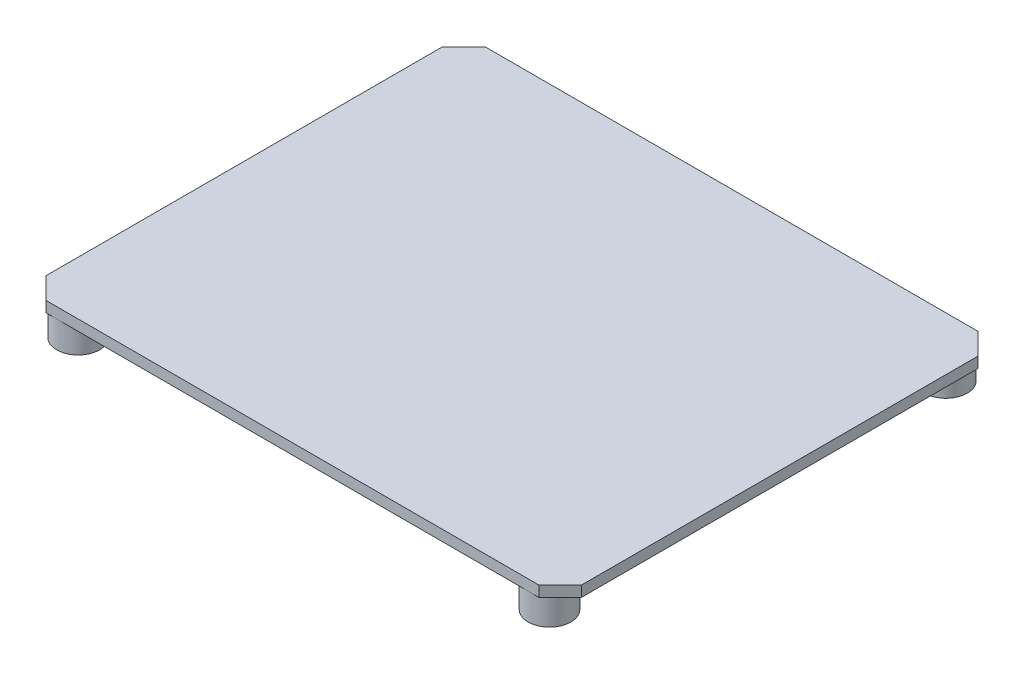
from build123d import *

# Parameters (mm, degrees)
SHADE_PLATE_DEPTH = 2
SKETCH2_R         = 4
POSTS_DEPTH       = 5.1
SKETCH3_R         = 1.25
POST_PILOTS_DEPTH = 6.5


with BuildPart() as part:
    # Sketch1 → Shade Plate (new body)
    with BuildSketch(Plane(origin=(0, 33.4, 0), x_dir=(1, 0, 0), z_dir=(0, 1, 0))):
        Polygon((-46, -102), (46, -102), (50, -98), (50, -24), (46, -20), (-46, -20), (-50, -24), (-50, -98), align=None)
    extrude(amount=SHADE_PLATE_DEPTH)

    # Sketch2 → Posts (add)
    with BuildSketch(Plane(origin=(0, 28.4, 0), x_dir=(1, 0, 0), z_dir=(0, 1, 0))):
        with Locations((-44, -24)):
            Circle(SKETCH2_R)
        with Locations((-44, -98)):
            Circle(SKETCH2_R)
        with Locations((44, -24)):
            Circle(SKETCH2_R)
        with Locations((44, -98)):
            Circle(SKETCH2_R)
    extrude(amount=POSTS_DEPTH)

    # Sketch3 → Post Pilots (cut)
    with BuildSketch(Plane(origin=(0, 27.9, 0), x_dir=(1, 0, 0), z_dir=(0, 1, 0))):
        with Locations((-44, -24)):
            Circle(SKETCH3_R)
        with Locations((-44, -98)):
            Circle(SKETCH3_R)
        with Locations((44, -24)):
            Circle(SKETCH3_R)
        with Locations((44, -98)):
            Circle(SKETCH3_R)
    extrude(amount=POST_PILOTS_DEPTH, mode=Mode.SUBTRACT)


solid = part.part
